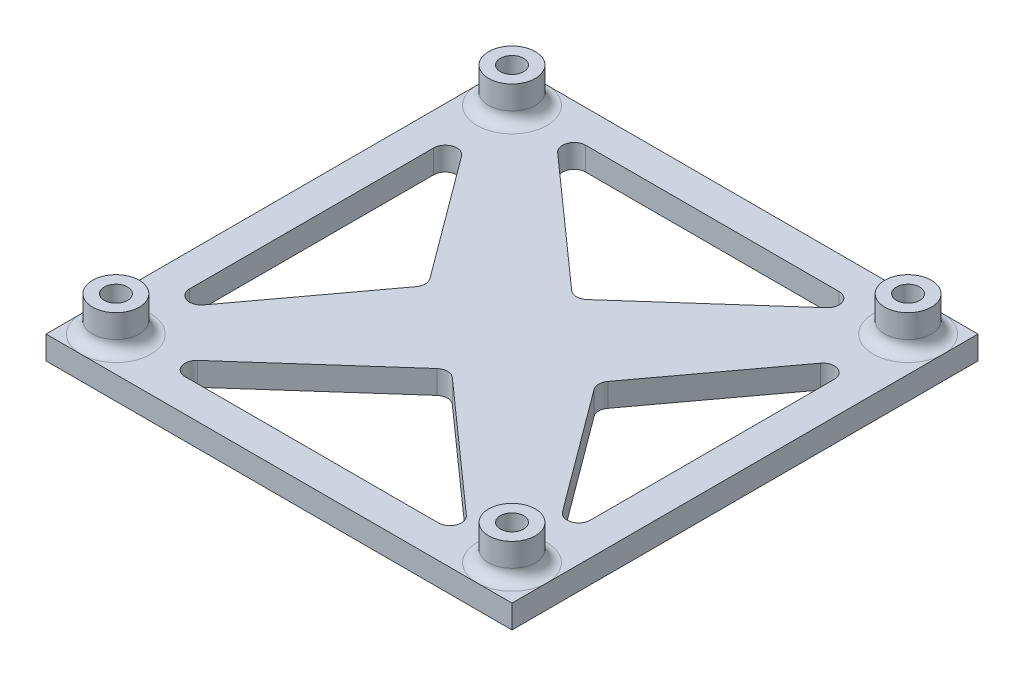
from build123d import *

# Parameters (mm, degrees)
SKETCH_1_W          = 200
SKETCH_1_H          = 200
SKETCH_1_R          = 5
EXTRUDE_1_DEPTH     = 7
SKETCH_2_R          = 10
SKETCH_2_R_2        = 5
EXTRUDE_2_DEPTH     = 15
SKETCH_3_W          = 200
SKETCH_3_H          = 200
EXTRUDE_3_DEPTH     = 3
CUT_EXTRUDE_2_DEPTH = 143.214626533
FILLET_2_R          = 5


with BuildPart() as part:
    # 草圖1 → 填料-伸長1 (new body)
    with BuildSketch(Plane(origin=(0, 0, 0), x_dir=(1, 0, 0), z_dir=(0, 1, 0))):
        Rectangle(SKETCH_1_W, SKETCH_1_H)
        with Locations(Location((85, 85, 0), (0, 0, 270))):
            Circle(SKETCH_1_R, mode=Mode.SUBTRACT)
        with Locations(Location((-85, 85, 0), (0, 0, 90))):
            Circle(SKETCH_1_R, mode=Mode.SUBTRACT)
        with Locations(Location((85, -85, 0), (0, 0, 90))):
            Circle(SKETCH_1_R, mode=Mode.SUBTRACT)
        with Locations(Location((-85, -85, 0), (0, 0, 270))):
            Circle(SKETCH_1_R, mode=Mode.SUBTRACT)
    extrude(amount=EXTRUDE_1_DEPTH)

    # 草圖2 → 填料-伸長2 (add)
    # profile 1 of 4: a face of its own
    with BuildSketch(Plane(origin=(0, 7, 0), x_dir=(1, 0, 0), z_dir=(0, 1, 0))):
        with Locations(Location((-85, 85, 0), (0, 0, 90))):
            Circle(SKETCH_2_R)
        with Locations(Location((-85, 85, 0), (0, 0, 90))):
            Circle(SKETCH_2_R_2, mode=Mode.SUBTRACT)
    # profile 2 of 4: a face of its own
    with BuildSketch(Plane(origin=(0, 7, 0), x_dir=(1, 0, 0), z_dir=(0, 1, 0))):
        with Locations(Location((85, 85, 0), (0, 0, 90))):
            Circle(SKETCH_2_R)
        with Locations(Location((85, 85, 0), (0, 0, 270))):
            Circle(SKETCH_2_R_2, mode=Mode.SUBTRACT)
    # profile 3 of 4: a face of its own
    with BuildSketch(Plane(origin=(0, 7, 0), x_dir=(1, 0, 0), z_dir=(0, 1, 0))):
        with Locations(Location((85, -85, 0), (0, 0, 90))):
            Circle(SKETCH_2_R)
        with Locations(Location((85, -85, 0), (0, 0, 90))):
            Circle(SKETCH_2_R_2, mode=Mode.SUBTRACT)
    # profile 4 of 4: a face of its own
    with BuildSketch(Plane(origin=(0, 7, 0), x_dir=(1, 0, 0), z_dir=(0, 1, 0))):
        with Locations(Location((-85, -85, 0), (0, 0, 90))):
            Circle(SKETCH_2_R)
        with Locations(Location((-85, -85, 0), (0, 0, 270))):
            Circle(SKETCH_2_R_2, mode=Mode.SUBTRACT)
    extrude(amount=EXTRUDE_2_DEPTH)

    # 草圖3 → 填料-伸長3 (add)
    with BuildSketch(Plane.XZ):
        Rectangle(SKETCH_3_W, SKETCH_3_H)
    extrude(amount=EXTRUDE_3_DEPTH)

    # 草圖6 → 除料-伸長2 (cut, through all)
    with BuildSketch(Plane(origin=(0, 7, 0), x_dir=(1, 0, 0), z_dir=(0, 1, 0))):
        Polygon((-67.5, 85.991963893), (0, 25.991963893), (67.5, 85.991963893), align=None)
        Polygon((85.991963893, -67.5), (85.991963893, 67.5), (35.991963893, 0), align=None)
        Polygon((-67.5, -85.991963893), (67.5, -85.991963893), (0, -25.991963893), align=None)
        Polygon((-85.991963893, 67.5), (-85.991963893, -67.5), (-35.991963893, 0), align=None)
    extrude(amount=-CUT_EXTRUDE_2_DEPTH, mode=Mode.SUBTRACT)

    # 圓角2
    fillet_2_edges = [part.edges().sort_by_distance(p)[0] for p in [
        (-67.5, 2, -85.991963893),
        (67.5, 2, -85.991963893),
        (0, 2, -25.991963893),
        (-85, 7, -75),
        (85, 7, -75),
        (85, 7, 95),
        (-85, 7, 95),
        (0, 2, 25.991963893),
        (67.5, 2, 85.991963893),
        (-67.5, 2, 85.991963893),
        (35.991963893, 2, 0),
        (85.991963893, 2, -67.5),
        (85.991963893, 2, 67.5),
        (-35.991963893, 2, 0),
        (-85.991963893, 2, 67.5),
        (-85.991963893, 2, -67.5),
    ]]
    fillet(fillet_2_edges, radius=FILLET_2_R - 0.0001)  # a hair under: the kernel refuses the full size


solid = part.part
